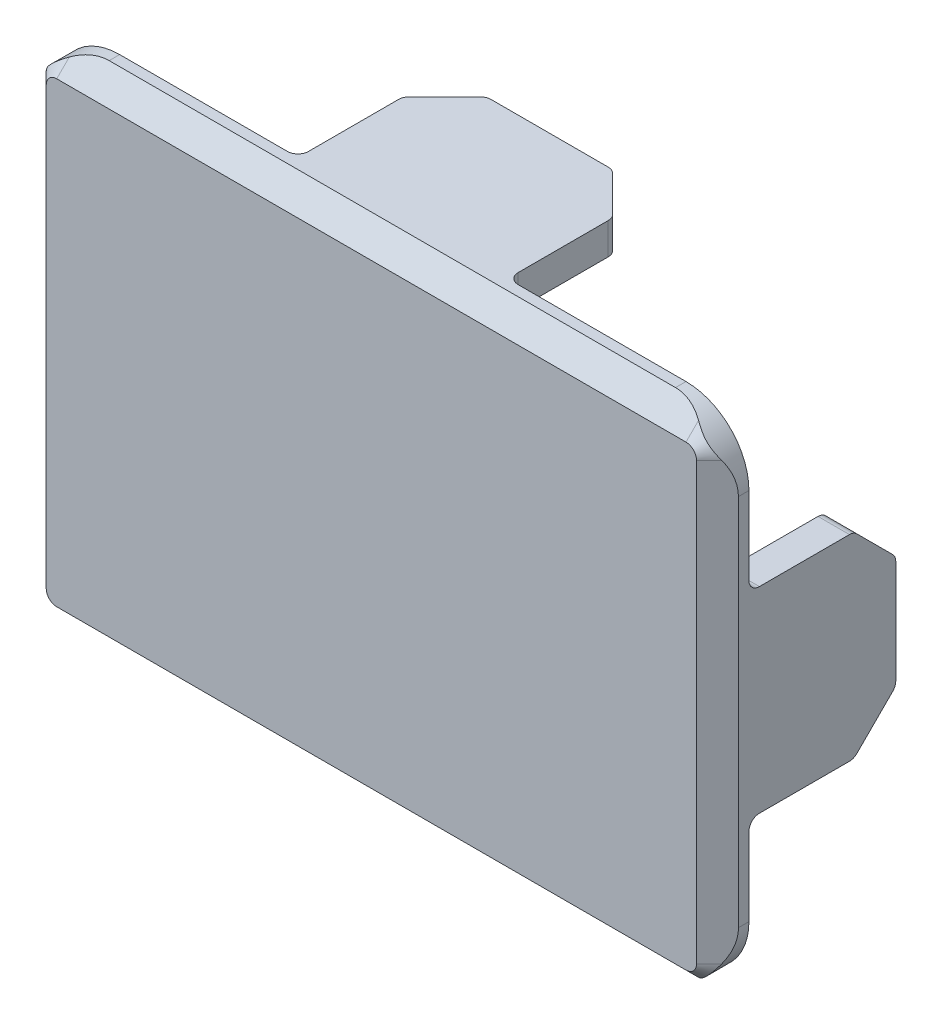
from build123d import *

# Parameters (mm, degrees)
EXTRUDE_1_DEPTH     = 1.5
CHAMFER_1_SIZE      = 1
EXTRUDE_3_DEPTH     = 1.5
EXTRUDE_4_DEPTH     = 1.5
EXTRUDE_5_DEPTH     = 1.5
FILLET_START        = -32
FILLET_2_DEPTH      = 3
FILLET_3_R          = 0.5
SKETCH_8_W          = 30
SKETCH_8_H          = 20.8
CUT_EXTRUDE_1_DEPTH = 0.7
FILLET_4_R          = 0.5
CUT_EXTRUDE_8_DEPTH = 39.881422299


with BuildPart() as part:
    # 草图1 → 凸台-拉伸1 (new body)
    with BuildSketch(Plane.XY):
        with BuildLine():
            Line((-29.75, -1.75), (-19.75, -1.75))
            Line((-19.75, -1.75), (-9.75, -1.75))
            Line((-9.75, -1.75), (0.25, -1.75))
            ThreePointArc((0.25, -1.75), (1.310660172, -1.310660172), (1.75, -0.25))
            Line((1.75, -0.25), (1.75, 5.475))
            Line((1.75, 5.475), (1.75, 14.835))
            Line((1.75, 14.835), (1.75, 20.55))
            ThreePointArc((1.75, 20.55), (1.310660172, 21.610660172), (0.25, 22.05))
            Line((0.25, 22.05), (-9.75, 22.05))
            Line((-9.75, 22.05), (-19.75, 22.05))
            Line((-19.75, 22.05), (-29.75, 22.05))
            ThreePointArc((-29.75, 22.05), (-30.810660172, 21.610660172), (-31.25, 20.55))
            Line((-31.25, 20.55), (-31.25, 14.835))
            Line((-31.25, 14.835), (-31.25, 5.475))
            Line((-31.25, 5.475), (-31.25, -0.25))
            ThreePointArc((-31.25, -0.25), (-30.810660172, -1.310660172), (-29.75, -1.75))
        make_face()
    extrude(amount=EXTRUDE_1_DEPTH)

    # 倒角1
    chamfer_1_edges = [part.edges().sort_by_distance(p)[0] for p in [
        (-14.75, -1.75, 1.5),
        (1.310660172, -1.310660172, 1.5),
        (1.75, 10.15, 1.5),
        (1.310660172, 21.610660172, 1.5),
        (-14.75, 22.05, 1.5),
        (-31.25, 10.15, 1.5),
        (-30.810660172, 21.610660172, 1.5),
        (-30.810660172, -1.310660172, 1.5),
    ]]
    chamfer(chamfer_1_edges, length=CHAMFER_1_SIZE)

    # 草图3 → 凸台-拉伸3 (add)
    with BuildSketch(Plane(origin=(0, 22.05, 0), x_dir=(1, 0, 0), z_dir=(0, 1, 0))):
        Polygon((-19.75, -0.450892119), (-9.75, -0.450892119), (-9.75, 5), (-11.75, 7), (-17.75, 7), (-19.75, 5), align=None)
    extrude_3 = extrude(amount=-EXTRUDE_3_DEPTH)

    # 镜向1: 凸台-拉伸3 across plane
    add(extrude_3.mirror(Plane.ZX.offset(10.15)))

    # 草图4 → 凸台-拉伸4 (add)
    with BuildSketch(Plane(origin=(1.75, 0, 0), x_dir=(0, 0, -1), z_dir=(1, 0, 0))):
        Polygon((-0.4, 14.835), (5, 14.835), (7, 12.835), (7, 7.475), (5, 5.475), (-0.4, 5.475), align=None)
    extrude(amount=-EXTRUDE_4_DEPTH)

    # 草图6 → 凸台-拉伸5 (add)
    with BuildSketch(Plane.ZY.offset(31.25)):
        with BuildLine():
            Line((0.32, 14.835), (0.32, 5.475))
            Line((0.32, 5.475), (-6.88, 5.475))
            ThreePointArc((-6.88, 5.475), (-6.031471863, 5.826471863), (-5.68, 6.675))
            Line((-5.68, 6.675), (-5.68, 13.635))
            ThreePointArc((-5.68, 13.635), (-6.031471863, 14.483528137), (-6.88, 14.835))
            Line((-6.88, 14.835), (0.32, 14.835))
        make_face()
    extrude(amount=-EXTRUDE_5_DEPTH)

    # 圆角2: read off the stored shape, not the designer's step
    # 圆角2 outline → 圆角2 (cut)
    with BuildSketch(Plane.YZ.offset(FILLET_START)):
        with BuildLine():
            Line((14.835, -6.88), (14.835, -5.68))
            ThreePointArc((14.835, -5.68), (14.669164079, -5.948328157), (14.355, -5.92))
            ThreePointArc((14.355, -5.92), (14.708312629, -6.343343686), (14.835, -6.88))
        make_face()
        with BuildLine():
            ThreePointArc((5.475, -6.88), (5.601687371, -6.343343686), (5.955, -5.92))
            ThreePointArc((5.955, -5.92), (5.640835921, -5.948328157), (5.475, -5.68))
            Line((5.475, -5.68), (5.475, -6.88))
        make_face()
    extrude(amount=FILLET_2_DEPTH, mode=Mode.SUBTRACT)

    # 圆角3
    fillet_3_edges = [part.edges().sort_by_distance(p)[0] for p in [
        (-9.75, -1, 0),
        (-19.75, -1, 0),
        (-19.75, -1, -5),
        (-9.75, -1, -5),
        (-11.75, -1, -7),
        (-17.75, -1, -7),
        (1, 5.475, -5),
        (1, 14.835, 0),
        (1, 14.835, -5),
        (1, 12.835, -7),
        (1, 7.475, -7),
        (1, 5.475, 0),
        (-30.5, 14.835, 0),
        (-30.5, 5.475, 0),
        (-9.75, 21.3, 0),
        (-19.75, 21.3, 0),
        (-9.75, 21.3, -5),
        (-19.75, 21.3, -5),
        (-17.75, 21.3, -7),
        (-11.75, 21.3, -7),
    ]]
    fillet(fillet_3_edges, radius=FILLET_3_R)

    # 草图8 → 切除-拉伸1 (cut)
    with BuildSketch(Plane(origin=(0, 0, 0), x_dir=(-1, 0, 0), z_dir=(0, 0, -1))):
        with Locations((14.75, 10.15)):
            Rectangle(SKETCH_8_W, SKETCH_8_H)
    extrude(amount=-CUT_EXTRUDE_1_DEPTH, mode=Mode.SUBTRACT)

    # 圆角4
    fillet_4_edges = [part.edges().sort_by_distance(p)[0] for p in [
        (-29.75, 20.55, 0.35),
        (-29.75, -0.25, 0.35),
        (0.25, -0.25, 0.35),
        (0.25, 20.55, 0.35),
    ]]
    fillet(fillet_4_edges, radius=FILLET_4_R)

    # 草图12 → 切除-拉伸8 (cut, through all)
    with BuildSketch(Plane(origin=(0, 0, 0), x_dir=(-1, 0, 0), z_dir=(0, 0, -1))):
        with BuildLine():
            Line((1.25, 22.05), (-0.25, 22.05))
            ThreePointArc((-0.25, 22.05), (-1.310660172, 21.610660172), (-1.75, 20.55))
            Line((-1.75, 20.55), (-1.75, 19.05))
            ThreePointArc((-1.75, 19.05), (-0.871320344, 21.171320344), (1.25, 22.05))
        make_face()
        with BuildLine():
            Line((31.25, 19.05), (31.25, 20.55))
            ThreePointArc((31.25, 20.55), (30.810660172, 21.610660172), (29.75, 22.05))
            Line((29.75, 22.05), (28.25, 22.05))
            ThreePointArc((28.25, 22.05), (30.371320344, 21.171320344), (31.25, 19.05))
        make_face()
        with BuildLine():
            Line((28.25, -1.75), (29.75, -1.75))
            ThreePointArc((29.75, -1.75), (30.810660172, -1.310660172), (31.25, -0.25))
            Line((31.25, -0.25), (31.25, 1.25))
            ThreePointArc((31.25, 1.25), (30.371320344, -0.871320344), (28.25, -1.75))
        make_face()
        with BuildLine():
            Line((-1.75, 1.25), (-1.75, -0.25))
            ThreePointArc((-1.75, -0.25), (-1.310660172, -1.310660172), (-0.25, -1.75))
            Line((-0.25, -1.75), (1.25, -1.75))
            ThreePointArc((1.25, -1.75), (-0.871320344, -0.871320344), (-1.75, 1.25))
        make_face()
    extrude(amount=-CUT_EXTRUDE_8_DEPTH, mode=Mode.SUBTRACT)


solid = part.part
